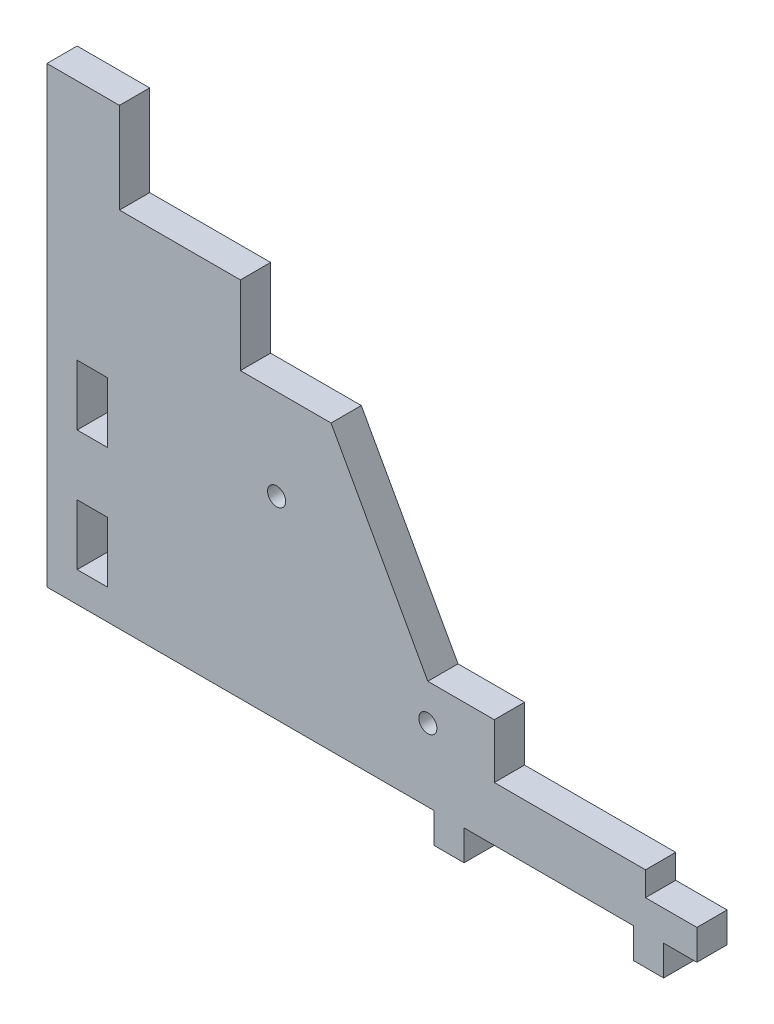
from build123d import *

# Parameters (mm, degrees)
ESQUISSE1_R        = 1.5
BOSS_EXTRU_1_DEPTH = 5
ESQUISSE2_W        = 5
ESQUISSE2_H        = 10
BOSS_EXTRU_2_DEPTH = 5


with BuildPart() as part:
    # Esquisse1 → Boss.-Extru.1 (new body)
    with BuildSketch(Plane.XY):
        Polygon((0, 0), (32, 0), (32, -5), (37, -5), (37, 0), (37, 18), (31, 18), (15, 47), (0, 47), align=None)
        with Locations((6, 32)):
            Circle(ESQUISSE1_R, mode=Mode.SUBTRACT)
        with Locations((31, 12)):
            Circle(ESQUISSE1_R, mode=Mode.SUBTRACT)
    extrude(amount=BOSS_EXTRU_1_DEPTH)

    # Esquisse2 → Boss.-Extru.2 (add)
    # profile 1 of 2: a face of its own
    with BuildSketch(Plane(origin=(0, 0, 0), x_dir=(-1, 0, 0), z_dir=(0, 0, -1))):
        Polygon((-65, 0), (-37, 0), (-37, 18), (-42, 18), (-42, 9), (-67, 9), (-67, 5), (-75.5, 5), (-75.5, 0), (-70, 0), (-70, -5), (-65, -5), align=None)
    # profile 2 of 2: a face of its own
    with BuildSketch(Plane(origin=(0, 0, 0), x_dir=(-1, 0, 0), z_dir=(0, 0, -1))):
        Polygon((0, 60), (0, 0), (32, 0), (32, 75), (20, 75), (20, 60), align=None)
        with Locations((24.5, 10)):
            Rectangle(ESQUISSE2_W, ESQUISSE2_H, mode=Mode.SUBTRACT)
        with Locations((24.5, 30)):
            Rectangle(ESQUISSE2_W, ESQUISSE2_H, mode=Mode.SUBTRACT)
    extrude(amount=-BOSS_EXTRU_2_DEPTH)


solid = part.part
